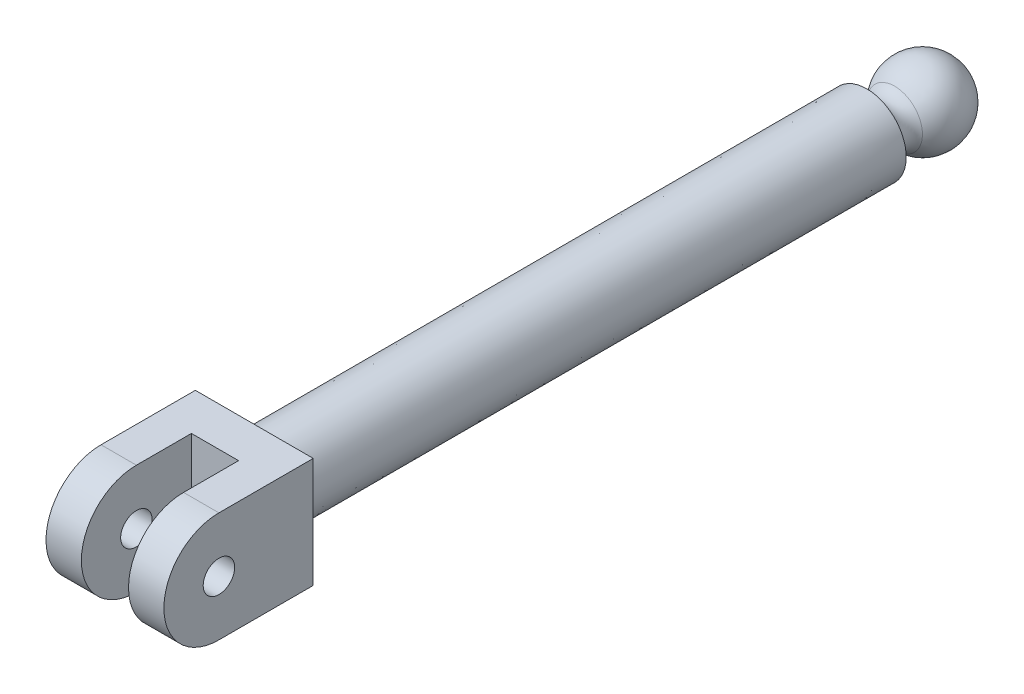
from build123d import *

# Parameters (mm, degrees)
SKETCH_1_R          = 2
EXTRUDE_1_DEPTH     = 5
SKETCH_2_W          = 15
SKETCH_2_H          = 14
EXTRUDE_2_DEPTH     = 5
CUT_EXTRUDE_1_DEPTH = 0.5
CUT_EXTRUDE_2_DEPTH = 0.5


# Read off the part's stored shape, not the designer's step: 旋转1
with BuildPart() as part:
    # 草图1 → 凸台-拉伸1 (new body)
    with BuildSketch(Plane(origin=(0, 0, 0), x_dir=(0, 0, -1), z_dir=(1, 0, 0))):
        with BuildLine():
            Line((0, 7), (7, 7))
            Line((7, 7), (7, -7))
            Line((7, -7), (0, -7))
            ThreePointArc((0, -7), (-7, 0), (0, 7))
        make_face()
        Circle(SKETCH_1_R, mode=Mode.SUBTRACT)
    extrude_1 = extrude(amount=EXTRUDE_1_DEPTH)

    # 草图2 → 凸台-拉伸2 (add)
    with BuildSketch(Plane(origin=(0, 0, -7), x_dir=(-1, 0, 0), z_dir=(0, 0, -1))):
        with Locations((2.5, 0)):
            Rectangle(SKETCH_2_W, SKETCH_2_H)
    extrude(amount=EXTRUDE_2_DEPTH)

    # 镜向1: 凸台-拉伸1 across plane
    add(extrude_1.mirror(Plane(origin=(-2.5, 0, 0), x_dir=(0, 0, 1), z_dir=(1, 0, 0))))

    # 旋转1 outline → 旋转1 (revolve)
    with BuildSketch(Plane(origin=(-2.5, 0.001459035, -1.77e-07), x_dir=(1, 0, 0), z_dir=(0, -0.9999999926083961, 0.00012158621526376601))):
        with BuildLine():
            Line((0, -11.99939198), (0, -101.999999911))
            add(Edge.make_bspline(
                [(0, -101.999999911), (0.649374565, -102.000631552), (1.36637391, -101.896134883), (2.14664433, -101.640285677), (2.900713445, -101.175064609), (4.050280545, -100.025777019), (4.488587079, -99.403162649), (4.802259983, -98.694270687), (4.967920299, -97.947271844), (5.003923175, -97.131598303), (5.005854013, -97.042976085), (5.00581972, -96.954701862), (5.003854844, -96.866858155), (4.962482411, -95.929533068), (4.746118591, -95.128843425), (4.388787557, -94.446984897), (3.976314487, -93.90027946), (3.539967456, -93.464038525)],
                knots=[7.026698353, 7.026698353, 7.026698353, 7.026698353, 7.026698353, 7.026698353, 7.854954324, 7.854954324, 7.854954324, 7.854954324, 8.516146676, 8.516146676, 8.516146676, 8.516146676, 8.597007798, 8.597007798, 8.597007798, 8.597007798, 9.38398712, 9.38398712, 9.38398712, 9.38398712, 9.38398712, 9.38398712], degree=5, weights=[1, 1, 1.002166416, 1.000644588, 1, 1, 0.998171528, 0.998141501, 1, 1, 0.999999762, 0.999999775, 1, 1, 1.000698327, 1.001864653, 1, 1]))
            ThreePointArc((3.539967456, -93.464038525), (3.091790234, -91.204536808), (5.009475048, -89.928333148))
            Line((5.009475048, -89.928333148), (4.999999963, -11.99939198))
            Line((4.999999963, -11.99939198), (0, -11.99939198))
        make_face()
    revolve(axis=Axis((-2.5, 0.001459035, -1.77e-07), (0, 0.00012158621526376601, 0.9999999926083961)))

    # 草图5 → 切除-拉伸1 (cut)
    with BuildSketch(Plane.ZY):
        with BuildLine():
            Line((-7, 7), (-7, -7))
            Line((-7, -7), (0, -7))
            ThreePointArc((0, -7), (7, 0), (0, 7))
            Line((0, 7), (-7, 7))
        make_face()
    extrude(amount=-CUT_EXTRUDE_1_DEPTH, mode=Mode.SUBTRACT)


with BuildPart() as mirror_2_1:
    # 镜向2: 凸台-拉伸1 across plane
    add(extrude_1.mirror(Plane(origin=(-2.5, 0, 0), x_dir=(0, 0, 1), z_dir=(1, 0, 0))))


with BuildPart() as part_1:
    add(part.part)

    # 镜向2 united with what the copies tou: union 镜向2_1
    add(mirror_2_1.part)

    # 草图6 → 切除-拉伸2 (cut)
    with BuildSketch(Plane(origin=(-5, 0, 0), x_dir=(0, 0, -1), z_dir=(1, 0, 0))):
        with BuildLine():
            Line((0, 7), (7, 7))
            Line((7, 7), (7, -7))
            Line((7, -7), (0, -7))
            ThreePointArc((0, -7), (-7, 0), (0, 7))
        make_face()
    extrude(amount=-CUT_EXTRUDE_2_DEPTH, mode=Mode.SUBTRACT)


solid = part_1.part
